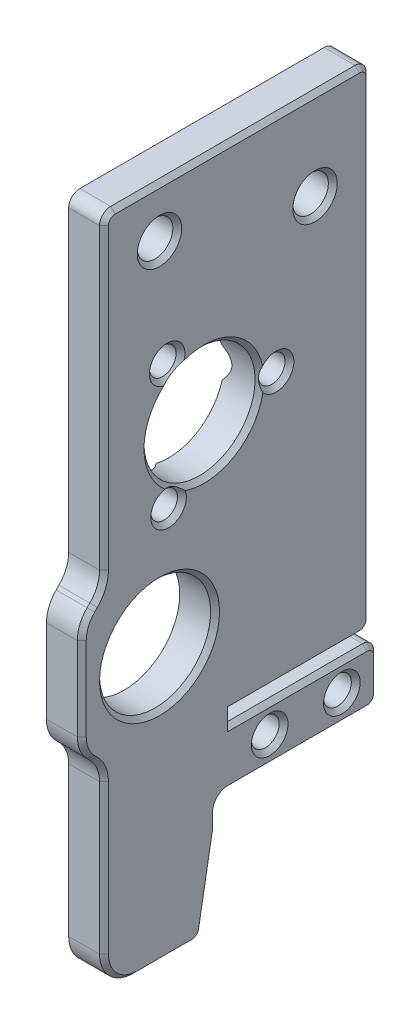
from build123d import *

# Parameters (mm, degrees)
BOSS_EXTRUDE1_DEPTH                             = 3.18
SKETCH2_4_OUTSIDE_W                             = 41.966
SKETCH2_4_OUTSIDE_H                             = 76.106
SKETCH2_4_OUTSIDE_R                             = 5
CUT_EXTRUDE2_DEPTH                              = 3.18
FILLET6_R                                       = 3
CSK_FOR_M2_FLAT_HEAD_MACHINE_SCREW2_D           = 2.4
CSK_FOR_M2_FLAT_HEAD_MACHINE_SCREW2_CSINK_D     = 4.4
CSK_FOR_M2_FLAT_HEAD_MACHINE_SCREW2_CSINK_ANGLE = 90
M3X0_5_TAPPED_HOLE1_D                           = 2.5
M3X0_5_TAPPED_HOLE1_DEPTH                       = 3.478924226
M3X0_5_TAPPED_HOLE1_TIP                         = 0.751075774
CHAMFER1_SIZE                                   = 8
CHAMFER1_SIZE2                                  = 1.410615846
FILLET7_R                                       = 1
SKETCH16_R                                      = 1.6
CUT_EXTRUDE3_DEPTH                              = 66.700665146
CHAMFER2_SIZE                                   = 0.4


with BuildPart() as part:
    # Sketch2 → Boss-Extrude1 (new body)
    with BuildSketch(Plane(origin=(0, 0, 0), x_dir=(0, 0, -1), z_dir=(1, 0, 0))):
        Polygon((0, 60.81), (24, 60.81), (24, 16.53), (11.52, 16.53), (11.52, 15.38), (24.67, 15.38), (24.67, 10.38), (10.17, 10.38), (10.17, 0), (0, 0), (0, 17.7), (-2, 19.7), (-2, 29.7), (0, 31.7), align=None)
    extrude(amount=-BOSS_EXTRUDE1_DEPTH)

    # Sketch2<4> outside → Cut-Extrude2 (cut)
    # profile 1 of 3: a face of its own
    with BuildSketch(Plane(origin=(0, 0, 0), x_dir=(0, 0, -1), z_dir=(1, 0, 0))):
        with Locations((11.335, 30.405)):
            Rectangle(SKETCH2_4_OUTSIDE_W, SKETCH2_4_OUTSIDE_H)
        Polygon((0, 60.81), (24, 60.81), (24, 16.53), (11.52, 16.53), (11.52, 15.38), (24.67, 15.38), (24.67, 10.38), (10.17, 10.38), (10.17, 0), (0, 0), (0, 17.7), (-2, 19.7), (-2, 29.7), (0, 31.7), align=None, mode=Mode.SUBTRACT)
    # profile 2 of 3: a face of its own
    with BuildSketch(Plane(origin=(0, 0, 0), x_dir=(0, 0, -1), z_dir=(1, 0, 0))):
        with Locations((5, 24.7)):
            Circle(SKETCH2_4_OUTSIDE_R)
    # profile 3 of 3: a face of its own
    with BuildSketch(Plane(origin=(0, 0, 0), x_dir=(0, 0, -1), z_dir=(1, 0, 0))):
        with Locations((9, 40.810865899)):
            Circle(SKETCH2_4_OUTSIDE_R)
    extrude(amount=-CUT_EXTRUDE2_DEPTH, mode=Mode.SUBTRACT)

    # Fillet6
    fillet6_edges = [part.edges().sort_by_distance(p)[0] for p in [
        (-1.59, 31.7, 0),
        (-1.59, 29.7, 2),
        (-1.59, 19.7, 2),
        (-1.59, 17.7, 0),
        (-1.59, 0, 0),
    ]]
    fillet(fillet6_edges, radius=FILLET6_R)

    # CSK for M2 Flat Head Machine Screw2 (through all)
    with Locations(Plane.ZY.offset(3.18)):
        with Locations((-5.688374042, 46.403998609), (-15.499607993, 40.882251751), (-5.812017965, 35.146347336)):
            CounterSinkHole(CSK_FOR_M2_FLAT_HEAD_MACHINE_SCREW2_D / 2, CSK_FOR_M2_FLAT_HEAD_MACHINE_SCREW2_CSINK_D / 2, counter_sink_angle=CSK_FOR_M2_FLAT_HEAD_MACHINE_SCREW2_CSINK_ANGLE)

    # M3x0.5 Tapped Hole1
    with Locations(Plane(origin=(0, 0, 0), x_dir=(0, 0, -1), z_dir=(1, 0, 0))):
        with Locations((21.42, 12.88), (14.92, 12.88)):
            Hole(M3X0_5_TAPPED_HOLE1_D / 2, depth=M3X0_5_TAPPED_HOLE1_DEPTH)
            with Locations((0, 0, -(M3X0_5_TAPPED_HOLE1_DEPTH + M3X0_5_TAPPED_HOLE1_TIP / 2))):  # 118° drill point
                Cone(0, M3X0_5_TAPPED_HOLE1_D / 2, M3X0_5_TAPPED_HOLE1_TIP, mode=Mode.SUBTRACT)

    # Chamfer1
    chamfer1_edges = [part.edges().sort_by_distance(p)[0] for p in [
        (-1.59, 0, -10.17),
    ]]
    chamfer1_side = [part.faces().sort_by_distance(p)[0] for p in [
        (-1.59, 5.19, -10.17),
    ]]
    chamfer(chamfer1_edges, length=CHAMFER1_SIZE, length2=CHAMFER1_SIZE2, reference=chamfer1_side[0])

    # Fillet7
    fillet7_edges = [part.edges().sort_by_distance(p)[0] for p in [
        (-1.59, 0, -8.759384154),
        (-1.59, 8, -10.17),
        (-1.59, 10.38, -10.17),
        (-1.59, 10.38, -24.67),
        (-1.59, 15.38, -24.67),
        (-1.59, 16.53, -24),
        (-1.59, 60.81, -24),
        (-1.59, 60.81, 0),
    ]]
    fillet(fillet7_edges, radius=FILLET7_R)

    # Sketch16 → Cut-Extrude3 (cut, through all)
    with BuildSketch(Plane.ZY.offset(3.18)):
        with Locations((-19, 52.81)):
            Circle(SKETCH16_R)
        with Locations((-5, 56.31)):
            Circle(SKETCH16_R)
    extrude(amount=-CUT_EXTRUDE3_DEPTH, mode=Mode.SUBTRACT)

    # Chamfer2
    # the kernel refuses this chamfer: 0.4 mm, written as the material it takes off along each edge
    with BuildSketch(Plane(origin=(0, 32.942640687, 3), x_dir=(0, 0, -1), z_dir=(0, 1, 0))) as chamfer2_piece_1:
        Polygon((3 + CHAMFER2_SIZE, 0), (3, CHAMFER2_SIZE), (3, 0), align=None)
    revolve(axis=Axis((0, 32.942640687, 3), (-1, 0, 0)), revolution_arc=45, mode=Mode.SUBTRACT)
    with BuildSketch(Plane(origin=(0, 35.146347336, -5.812017965), x_dir=(0, 0, -1), z_dir=(0, -1, 0))) as chamfer2_piece_2:
        Polygon((1.2 + CHAMFER2_SIZE, 0), (1.2, -CHAMFER2_SIZE), (1.2, 0), align=None)
    revolve(axis=Axis((0, 35.146347336, -5.812017965), (1, 0, 0)), mode=Mode.SUBTRACT)
    with BuildSketch(Plane(origin=(0, 40.882251751, -15.499607993), x_dir=(0, 0, -1), z_dir=(0, -1, 0))) as chamfer2_piece_3:
        Polygon((1.2 + CHAMFER2_SIZE, 0), (1.2, -CHAMFER2_SIZE), (1.2, 0), align=None)
    revolve(axis=Axis((0, 40.882251751, -15.499607993), (1, 0, 0)), mode=Mode.SUBTRACT)
    with BuildSketch(Plane(origin=(0, 46.403998609, -5.688374042), x_dir=(0, 0, -1), z_dir=(0, -1, 0))) as chamfer2_piece_4:
        Polygon((1.2 + CHAMFER2_SIZE, 0), (1.2, -CHAMFER2_SIZE), (1.2, 0), align=None)
    revolve(axis=Axis((0, 46.403998609, -5.688374042), (1, 0, 0)), mode=Mode.SUBTRACT)
    with BuildSketch(Plane(origin=(0, 12.88, -14.92), x_dir=(0, 0, 1), z_dir=(0, -1, 0))) as chamfer2_piece_5:
        Polygon((1.25 + CHAMFER2_SIZE, 0), (1.25, CHAMFER2_SIZE), (1.25, 0), align=None)
    revolve(axis=Axis((0, 12.88, -14.92), (-1, 0, 0)), mode=Mode.SUBTRACT)
    with BuildSketch(Plane(origin=(0, 12.88, -21.42), x_dir=(0, 0, 1), z_dir=(0, -1, 0))) as chamfer2_piece_6:
        Polygon((1.25 + CHAMFER2_SIZE, 0), (1.25, CHAMFER2_SIZE), (1.25, 0), align=None)
    revolve(axis=Axis((0, 12.88, -21.42), (-1, 0, 0)), mode=Mode.SUBTRACT)
    with BuildSketch(Plane(origin=(0, 0, -7.920284523), x_dir=(0.027495876610586518, 0.9996219169112966, 0), z_dir=(0, 0, 1))) as chamfer2_piece_7:
        Polygon((CHAMFER2_SIZE * 0.999621916911, CHAMFER2_SIZE * 0.0274958766106), (-CHAMFER2_SIZE * 0.0274958766106, CHAMFER2_SIZE * 0.999621916911), (0, 0), align=None)
    extrude(amount=4.920284523, mode=Mode.SUBTRACT)
    with BuildSketch(Plane(origin=(0, 7.913840486, -10.154807753), x_dir=(0.0274958766105864, 0.17358252422757048, 0.9844354138551703), z_dir=(0, -0.9848077530122081, 0.17364817766693047))) as chamfer2_piece_8:
        Polygon((CHAMFER2_SIZE * 0.999621916911, CHAMFER2_SIZE * 0.0274958766106), (-CHAMFER2_SIZE * 0.0274958766106, CHAMFER2_SIZE * 0.999621916911), (0, 0), align=None)
    extrude(amount=7.1968246, mode=Mode.SUBTRACT)
    with BuildSketch(Plane(origin=(0, 9.38, -10.17), x_dir=(0.027495876610586306, 0, 0.9996219169112966), z_dir=(0, -1, 0))) as chamfer2_piece_9:
        Polygon((CHAMFER2_SIZE * 0.999621916911, CHAMFER2_SIZE * 0.0274958766106), (-CHAMFER2_SIZE * 0.0274958766106, CHAMFER2_SIZE * 0.999621916911), (0, 0), align=None)
    extrude(amount=1.292511336, mode=Mode.SUBTRACT)
    with BuildSketch(Plane(origin=(0, 10.38, -23.67), x_dir=(0.027495876610586306, 0.9996219169112966, 0), z_dir=(0, 0, 1))) as chamfer2_piece_10:
        Polygon((CHAMFER2_SIZE * 0.999621916911, CHAMFER2_SIZE * 0.0274958766106), (-CHAMFER2_SIZE * 0.0274958766106, CHAMFER2_SIZE * 0.999621916911), (0, 0), align=None)
    extrude(amount=12.5, mode=Mode.SUBTRACT)
    with BuildSketch(Plane(origin=(0, 14.38, -24.67), x_dir=(0.027495876610586487, 0, 0.9996219169112966), z_dir=(0, -1, 0))) as chamfer2_piece_11:
        Polygon((CHAMFER2_SIZE * 0.999621916911, CHAMFER2_SIZE * 0.0274958766106), (-CHAMFER2_SIZE * 0.0274958766106, CHAMFER2_SIZE * 0.999621916911), (0, 0), align=None)
    extrude(amount=3, mode=Mode.SUBTRACT)
    with BuildSketch(Plane(origin=(0, 15.38, -11.52), x_dir=(0.027495876610586306, -0.9996219169112966, 0), z_dir=(0, 0, -1))) as chamfer2_piece_12:
        Polygon((CHAMFER2_SIZE * 0.999621916911, CHAMFER2_SIZE * 0.0274958766106), (-CHAMFER2_SIZE * 0.0274958766106, CHAMFER2_SIZE * 0.999621916911), (0, 0), align=None)
    extrude(amount=12.15, mode=Mode.SUBTRACT)
    with BuildSketch(Plane(origin=(0, 59.81, -24), x_dir=(0.027495876610586487, 0, 0.9996219169112966), z_dir=(0, -1, 0))) as chamfer2_piece_13:
        Polygon((CHAMFER2_SIZE * 0.999621916911, CHAMFER2_SIZE * 0.0274958766106), (-CHAMFER2_SIZE * 0.0274958766106, CHAMFER2_SIZE * 0.999621916911), (0, 0), align=None)
    extrude(amount=42.28, mode=Mode.SUBTRACT)
    with BuildSketch(Plane(origin=(0, 60.81, -1), x_dir=(0.027495876610586726, -0.9996219169112966, 0), z_dir=(0, 0, -1))) as chamfer2_piece_14:
        Polygon((CHAMFER2_SIZE * 0.999621916911, CHAMFER2_SIZE * 0.0274958766106), (-CHAMFER2_SIZE * 0.0274958766106, CHAMFER2_SIZE * 0.999621916911), (0, 0), align=None)
    extrude(amount=22, mode=Mode.SUBTRACT)
    with BuildSketch(Plane(origin=(0, 16.53, -11.52), x_dir=(0.027495876610586306, 0, 0.9996219169112966), z_dir=(0, -1, 0))) as chamfer2_piece_15:
        Polygon((CHAMFER2_SIZE * 0.999621916911, CHAMFER2_SIZE * 0.0274958766106), (-CHAMFER2_SIZE * 0.0274958766106, CHAMFER2_SIZE * 0.999621916911), (0, 0), align=None)
    extrude(amount=1.15, mode=Mode.SUBTRACT)
    with BuildSketch(Plane(origin=(0, 59.81, -1), x_dir=(0, 1, 0), z_dir=(0, 0, -1))) as chamfer2_piece_16:
        Polygon((1 - CHAMFER2_SIZE, 0), (1, -CHAMFER2_SIZE), (1, 0), align=None)
    revolve(axis=Axis((0, 59.81, -1), (1, 0, 0)), revolution_arc=90, mode=Mode.SUBTRACT)
    with BuildSketch(Plane(origin=(0, 59.81, -23), x_dir=(0, 0, -1), z_dir=(0, -1, 0))) as chamfer2_piece_17:
        Polygon((1 - CHAMFER2_SIZE, 0), (1, -CHAMFER2_SIZE), (1, 0), align=None)
    revolve(axis=Axis((0, 59.81, -23), (1, 0, 0)), revolution_arc=90, mode=Mode.SUBTRACT)
    with BuildSketch(Plane(origin=(0, 1, -7.920284523), x_dir=(0, -0.17364817766693164, -0.9848077530122079), z_dir=(0, 0.9848077530122079, -0.17364817766693164))) as chamfer2_piece_18:
        Polygon((1 - CHAMFER2_SIZE, 0), (1, CHAMFER2_SIZE), (1, 0), align=None)
    revolve(axis=Axis((0, 1, -7.920284523), (-1, 0, 0)), revolution_arc=80, mode=Mode.SUBTRACT)
    with BuildSketch(Plane(origin=(0, 8.087488664, -9.17), x_dir=(0, 0, -1), z_dir=(0, 1, 0))) as chamfer2_piece_19:
        Polygon((1 - CHAMFER2_SIZE, 0), (1, CHAMFER2_SIZE), (1, 0), align=None)
    revolve(axis=Axis((0, 8.087488664, -9.17), (-1, 0, 0)), revolution_arc=10, mode=Mode.SUBTRACT)
    with BuildSketch(Plane(origin=(0, 14.38, -23.67), x_dir=(0, 0, -1), z_dir=(0, -1, 0))) as chamfer2_piece_20:
        Polygon((1 - CHAMFER2_SIZE, 0), (1, -CHAMFER2_SIZE), (1, 0), align=None)
    revolve(axis=Axis((0, 14.38, -23.67), (1, 0, 0)), revolution_arc=90, mode=Mode.SUBTRACT)
    with BuildSketch(Plane(origin=(0, 16.53, -23), x_dir=(0.027495876610586487, 0.9996219169112966, 0), z_dir=(0, 0, 1))) as chamfer2_piece_21:
        Polygon((CHAMFER2_SIZE * 0.999621916911, CHAMFER2_SIZE * 0.0274958766106), (-CHAMFER2_SIZE * 0.0274958766106, CHAMFER2_SIZE * 0.999621916911), (0, 0), align=None)
    extrude(amount=11.48, mode=Mode.SUBTRACT)
    with BuildSketch(Plane(origin=(0, 11.38, -23.67), x_dir=(0, -1, 0), z_dir=(0, 0, 1))) as chamfer2_piece_22:
        Polygon((1 - CHAMFER2_SIZE, 0), (1, -CHAMFER2_SIZE), (1, 0), align=None)
    revolve(axis=Axis((0, 11.38, -23.67), (1, 0, 0)), revolution_arc=90, mode=Mode.SUBTRACT)
    with BuildSketch(Plane(origin=(0, 17.53, -23), x_dir=(0, -1, 0), z_dir=(0, 0, 1))) as chamfer2_piece_23:
        Polygon((1 - CHAMFER2_SIZE, 0), (1, -CHAMFER2_SIZE), (1, 0), align=None)
    revolve(axis=Axis((0, 17.53, -23), (1, 0, 0)), revolution_arc=90, mode=Mode.SUBTRACT)
    with BuildSketch(Plane(origin=(0, 9.38, -11.17), x_dir=(0, 0, 1), z_dir=(0, -1, 0))) as chamfer2_piece_24:
        Polygon((1 + CHAMFER2_SIZE, 0), (1, CHAMFER2_SIZE), (1, 0), align=None)
    revolve(axis=Axis((0, 9.38, -11.17), (-1, 0, 0)), revolution_arc=90, mode=Mode.SUBTRACT)
    with BuildSketch(Plane(origin=(0, 52.81, -19), x_dir=(0, 0, 1), z_dir=(0, -1, 0))) as chamfer2_piece_25:
        Polygon((1.6 + CHAMFER2_SIZE, 0), (1.6, CHAMFER2_SIZE), (1.6, 0), align=None)
    revolve(axis=Axis((0, 52.81, -19), (-1, 0, 0)), mode=Mode.SUBTRACT)
    with BuildSketch(Plane(origin=(0, 56.31, -5), x_dir=(0, 0, 1), z_dir=(0, -1, 0))) as chamfer2_piece_26:
        Polygon((1.6 + CHAMFER2_SIZE, 0), (1.6, CHAMFER2_SIZE), (1.6, 0), align=None)
    revolve(axis=Axis((0, 56.31, -5), (-1, 0, 0)), mode=Mode.SUBTRACT)
    with BuildSketch(Plane(origin=(0, 24.7, -5), x_dir=(0, 0, -1), z_dir=(0, -1, 0))) as chamfer2_piece_27:
        Polygon((5 + CHAMFER2_SIZE, 0), (5, -CHAMFER2_SIZE), (5, 0), align=None)
    revolve(axis=Axis((0, 24.7, -5), (1, 0, 0)), mode=Mode.SUBTRACT)
    with BuildSketch(Plane(origin=(0, 40.810865899, -9), x_dir=(0, 0, -1), z_dir=(0, -1, 0))) as chamfer2_piece_28:
        Polygon((5 + CHAMFER2_SIZE, 0), (5, -CHAMFER2_SIZE), (5, 0), align=None)
    revolve(axis=Axis((0, 40.810865899, -9), (1, 0, 0)), mode=Mode.SUBTRACT)
    with BuildSketch(Plane(origin=(0, 3, 0), x_dir=(0.02749587661058638, 0, -0.9996219169112966), z_dir=(0, 1, 0))) as chamfer2_piece_29:
        Polygon((CHAMFER2_SIZE * 0.999621916911, CHAMFER2_SIZE * 0.0274958766106), (-CHAMFER2_SIZE * 0.0274958766106, CHAMFER2_SIZE * 0.999621916911), (0, 0), align=None)
    extrude(amount=13.457359313, mode=Mode.SUBTRACT)
    with BuildSketch(Plane(origin=(0, 32.942640687, 0), x_dir=(0.027495876610586317, 0, -0.9996219169112966), z_dir=(0, 1, 0))) as chamfer2_piece_30:
        Polygon((CHAMFER2_SIZE * 0.999621916911, CHAMFER2_SIZE * 0.0274958766106), (-CHAMFER2_SIZE * 0.0274958766106, CHAMFER2_SIZE * 0.999621916911), (0, 0), align=None)
    extrude(amount=26.867359313, mode=Mode.SUBTRACT)
    with BuildSketch(Plane(origin=(0, 30.578679656, 1.121320344), x_dir=(0.02749587661058647, -0.7068394360706819, -0.7068394360706651), z_dir=(0, 0.7071067811865392, -0.7071067811865559)), Plane(origin=(0, 18.578679656, 0.878679656), x_dir=(0.027495876610586507, 0.706839436070683, -0.7068394360706641), z_dir=(0, 0.7071067811865381, 0.707106781186557))) as chamfer2_piece_31:
        Polygon((CHAMFER2_SIZE * 0.999621916911, CHAMFER2_SIZE * 0.0274958766106), (-CHAMFER2_SIZE * 0.0274958766106, CHAMFER2_SIZE * 0.999621916911), (0, 0), align=None)
    extrude(amount=0.343145751, mode=Mode.SUBTRACT)
    with BuildSketch(Plane(origin=(0, 20.942640687, 2), x_dir=(0.02749587661058645, 0, -0.9996219169112966), z_dir=(0, 1, 0))) as chamfer2_piece_32:
        Polygon((CHAMFER2_SIZE * 0.999621916911, CHAMFER2_SIZE * 0.0274958766106), (-CHAMFER2_SIZE * 0.0274958766106, CHAMFER2_SIZE * 0.999621916911), (0, 0), align=None)
    extrude(amount=7.514718626, mode=Mode.SUBTRACT)
    with BuildSketch(Plane(origin=(0, 28.457359313, -1), x_dir=(0, 0.7071067811865557, 0.7071067811865395), z_dir=(0, 0.7071067811865395, -0.7071067811865557))) as chamfer2_piece_33:
        Polygon((3 - CHAMFER2_SIZE, 0), (3, -CHAMFER2_SIZE), (3, 0), align=None)
    revolve(axis=Axis((0, 28.457359313, -1), (1, 0, 0)), revolution_arc=45, mode=Mode.SUBTRACT)
    with BuildSketch(Plane(origin=(0, 20.942640687, -1), x_dir=(0, 0, 1), z_dir=(0, 1, 0))) as chamfer2_piece_34:
        Polygon((3 - CHAMFER2_SIZE, 0), (3, -CHAMFER2_SIZE), (3, 0), align=None)
    revolve(axis=Axis((0, 20.942640687, -1), (1, 0, 0)), revolution_arc=45, mode=Mode.SUBTRACT)
    with BuildSketch(Plane(origin=(0, 3, -3), x_dir=(0, 0, 1), z_dir=(0, 1, 0))) as chamfer2_piece_35:
        Polygon((3 - CHAMFER2_SIZE, 0), (3, -CHAMFER2_SIZE), (3, 0), align=None)
    revolve(axis=Axis((0, 3, -3), (1, 0, 0)), revolution_arc=90, mode=Mode.SUBTRACT)
    with BuildSketch(Plane(origin=(0, 16.457359313, 3), x_dir=(0, 0.707106781186557, -0.707106781186538), z_dir=(0, 0.707106781186538, 0.707106781186557))) as chamfer2_piece_36:
        Polygon((3 + CHAMFER2_SIZE, 0), (3, CHAMFER2_SIZE), (3, 0), align=None)
    revolve(axis=Axis((0, 16.457359313, 3), (-1, 0, 0)), revolution_arc=45, mode=Mode.SUBTRACT)
    with BuildSketch(Plane(origin=(0, 15.38, -10.491326805), x_dir=(0.027495876610586306, -0.9996219169112966, 0), z_dir=(0, 0, -1))) as chamfer2_piece_37a_section:
        Polygon((CHAMFER2_SIZE * 0.999621916911, CHAMFER2_SIZE * 0.0274958766106), (-CHAMFER2_SIZE * 0.0274958766106, CHAMFER2_SIZE * 0.999621916911), (0, 0), align=None)
    chamfer2_piece_37a = extrude(amount=13.178673195, mode=Mode.PRIVATE)
    chamfer2_piece_37a = split(chamfer2_piece_37a, bisect_by=Plane(origin=(-0.131917451, 15.248082549, -11.52), z_dir=(0, 0, 1)), keep=Keep.TOP, mode=Mode.PRIVATE)
    with BuildSketch(Plane(origin=(0, 16.53, -11.52), x_dir=(0.027495876610586306, 0, 0.9996219169112966), z_dir=(0, -1, 0))) as chamfer2_piece_37b_section:
        Polygon((CHAMFER2_SIZE * 0.999621916911, CHAMFER2_SIZE * 0.0274958766106), (-CHAMFER2_SIZE * 0.0274958766106, CHAMFER2_SIZE * 0.999621916911), (0, 0), align=None)
    chamfer2_piece_37b = extrude(amount=2.178673195, mode=Mode.PRIVATE)
    chamfer2_piece_37b = split(chamfer2_piece_37b, bisect_by=Plane(origin=(-0.131917451, 15.38, -11.388082549), z_dir=(0, -1, 0)), keep=Keep.TOP, mode=Mode.PRIVATE)
    chamfer2_piece_37 = chamfer2_piece_37a & chamfer2_piece_37b
    add(chamfer2_piece_37, mode=Mode.SUBTRACT)
    with BuildSketch(Plane(origin=(0, 17.558673195, -11.52), x_dir=(0.027495876610586306, 0, 0.9996219169112966), z_dir=(0, -1, 0))) as chamfer2_piece_38a_section:
        Polygon((CHAMFER2_SIZE * 0.999621916911, CHAMFER2_SIZE * 0.0274958766106), (-CHAMFER2_SIZE * 0.0274958766106, CHAMFER2_SIZE * 0.999621916911), (0, 0), align=None)
    chamfer2_piece_38a = extrude(amount=2.178673195, mode=Mode.PRIVATE)
    chamfer2_piece_38a = split(chamfer2_piece_38a, bisect_by=Plane(origin=(-0.131917451, 16.53, -11.388082549), z_dir=(0, 1, 0)), keep=Keep.TOP, mode=Mode.PRIVATE)
    with BuildSketch(Plane(origin=(0, 16.53, -23), x_dir=(0.027495876610586487, 0.9996219169112966, 0), z_dir=(0, 0, 1))) as chamfer2_piece_38b_section:
        Polygon((CHAMFER2_SIZE * 0.999621916911, CHAMFER2_SIZE * 0.0274958766106), (-CHAMFER2_SIZE * 0.0274958766106, CHAMFER2_SIZE * 0.999621916911), (0, 0), align=None)
    chamfer2_piece_38b = extrude(amount=12.508673195, mode=Mode.PRIVATE)
    chamfer2_piece_38b = split(chamfer2_piece_38b, bisect_by=Plane(origin=(-0.131917451, 16.661917451, -11.52), z_dir=(0, 0, 1)), keep=Keep.TOP, mode=Mode.PRIVATE)
    chamfer2_piece_38 = chamfer2_piece_38a & chamfer2_piece_38b
    add(chamfer2_piece_38, mode=Mode.SUBTRACT)


solid = part.part
